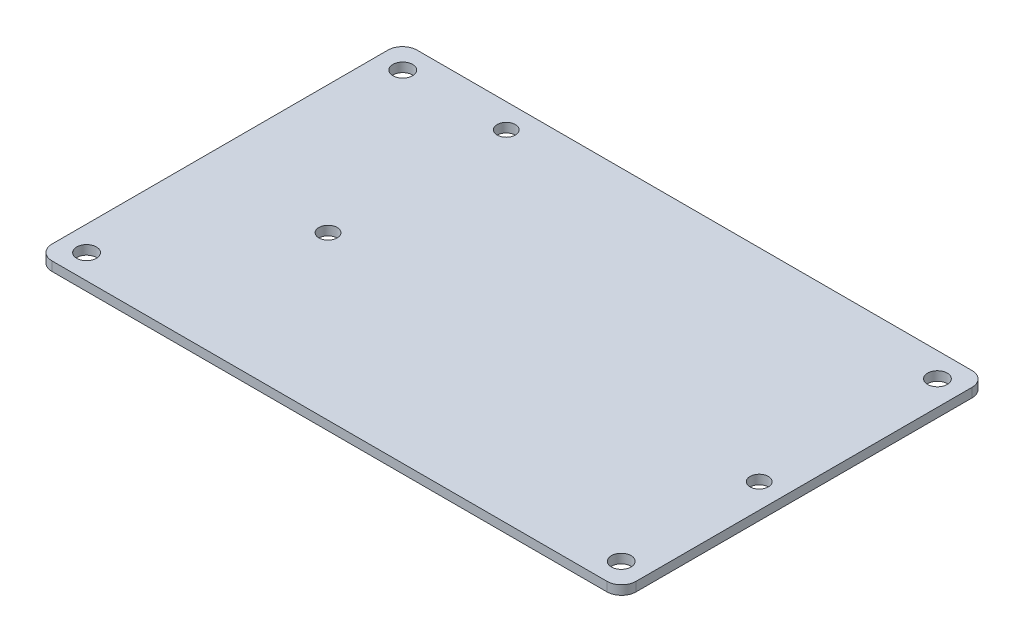
from build123d import *

# Parameters (mm, degrees)
SKETCH1_R           = 1.5875
SKETCH1_R_2         = 1.7145
BOSS_EXTRUDE1_DEPTH = 1.6


with BuildPart() as part:
    # Sketch1 → Boss-Extrude1 (new body)
    with BuildSketch(Plane(origin=(0, 0, 0), x_dir=(1, 0, 0), z_dir=(0, 1, 0))):
        with BuildLine():
            Line((0, 60.96), (0, 2.54))
            ThreePointArc((0, 2.54), (0.743948776, 0.743948776), (2.54, 0))
            Line((2.54, 0), (99.06, 0))
            ThreePointArc((99.06, 0), (100.856051224, 0.743948776), (101.6, 2.54))
            Line((101.6, 2.54), (101.6, 60.96))
            ThreePointArc((101.6, 60.96), (100.856051224, 62.756051224), (99.06, 63.5))
            Line((99.06, 63.5), (2.54, 63.5))
            ThreePointArc((2.54, 63.5), (0.743948776, 62.756051224), (0, 60.96))
        make_face()
        with Locations((22.3, 59.25)):
            Circle(SKETCH1_R, mode=Mode.SUBTRACT)
        with Locations((22.3, 28.25)):
            Circle(SKETCH1_R, mode=Mode.SUBTRACT)
        with Locations((97.3, 28.25)):
            Circle(SKETCH1_R, mode=Mode.SUBTRACT)
        with Locations((97.3, 4.25)):
            Circle(SKETCH1_R_2, mode=Mode.SUBTRACT)
        with Locations((4.3, 4.25)):
            Circle(SKETCH1_R_2, mode=Mode.SUBTRACT)
        with Locations((4.3, 59.25)):
            Circle(SKETCH1_R_2, mode=Mode.SUBTRACT)
        with Locations((97.3, 59.25)):
            Circle(SKETCH1_R_2, mode=Mode.SUBTRACT)
    extrude(amount=BOSS_EXTRUDE1_DEPTH)


solid = part.part
